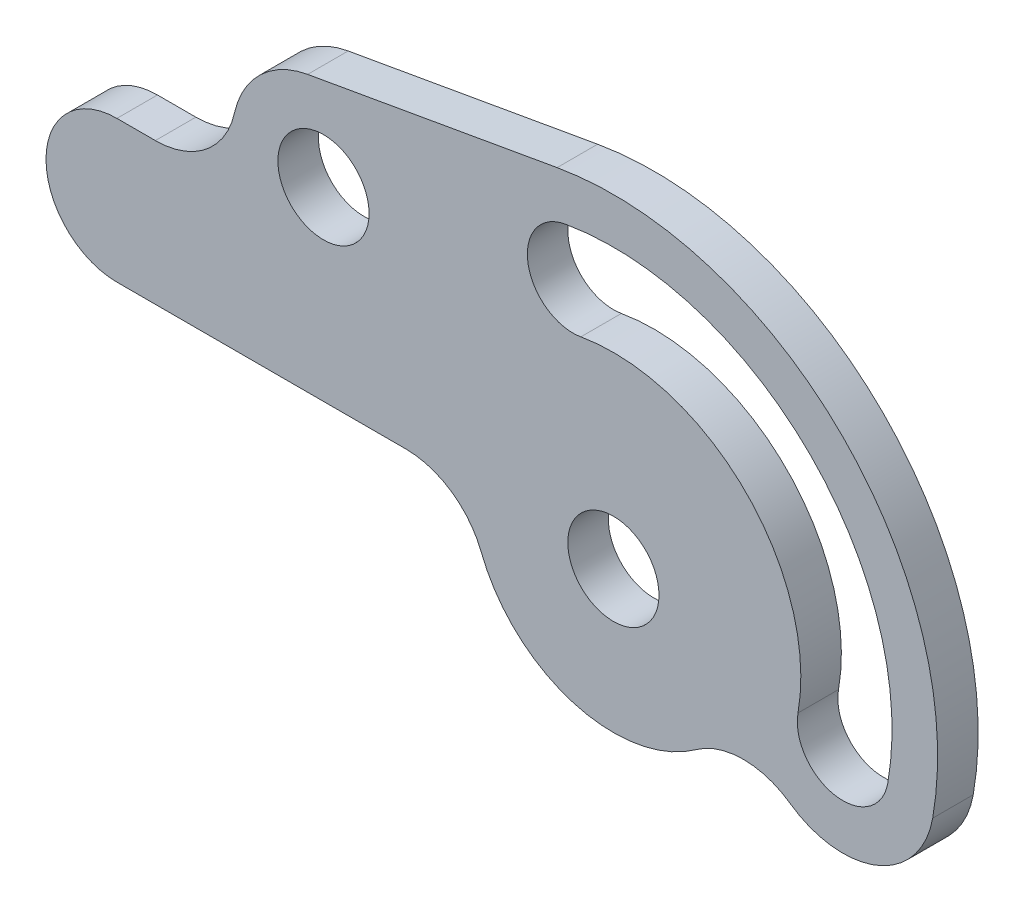
from build123d import *

# Parameters (mm, degrees)
SKETCH1_R           = 1.7859375
BOSS_EXTRUDE1_DEPTH = 1.5875
FILLET1_R           = 3.175


with BuildPart() as part:
    # Sketch1 → Boss-Extrude1 (new body)
    with BuildSketch(Plane.XY):
        with BuildLine():
            Line((-14.492018868, 5.55625), (-19.446875, 5.55625))
            ThreePointArc((-19.446875, 5.55625), (-22.225, 2.778125), (-19.446875, 0))
            Line((-19.446875, 0), (-5.55625, 0))
            ThreePointArc((-5.55625, 0), (-0.484259056, -5.535106795), (5.471838092, -0.964832608))
            ThreePointArc((5.471838092, -0.964832608), (8.369198647, -5.102692458), (12.507058463, -2.205331856))
            ThreePointArc((12.507058463, -2.205331856), (8.980256121, 8.980256121), (-2.205331856, 12.507058463))
            Line((-2.205331856, 12.507058463), (-11.976471281, 10.78414295))
            ThreePointArc((-11.976471281, 10.78414295), (-14.574868615, 8.815275161), (-14.492018868, 5.55625))
        make_face()
        with Locations((-11.356221696, 7.266532758)):
            Circle(SKETCH1_R, mode=Mode.SUBTRACT)
        with BuildLine():
            ThreePointArc((-1.895207064, 10.748253367), (7.717407604, 7.717407604), (10.748253367, -1.895207064))
            ThreePointArc((10.748253367, -1.895207064), (8.679323478, -3.343887368), (7.230643174, -1.274957479))
            ThreePointArc((7.230643174, -1.274957479), (5.19171057, 5.19171057), (-1.274957479, 7.230643174))
            ThreePointArc((-1.274957479, 7.230643174), (-3.343887368, 8.679323478), (-1.895207064, 10.748253367))
        make_face(mode=Mode.SUBTRACT)
        Circle(SKETCH1_R, mode=Mode.SUBTRACT)
    extrude(amount=BOSS_EXTRUDE1_DEPTH)

    # Fillet1
    fillet1_edges = [part.edges().sort_by_distance(p)[0] for p in [
        (5.471838092, -0.964832608, 0.79375),
        (-5.55625, 0, 0.79375),
        (-14.492018868, 5.55625, 0.79375),
    ]]
    fillet(fillet1_edges, radius=FILLET1_R)


solid = part.part
